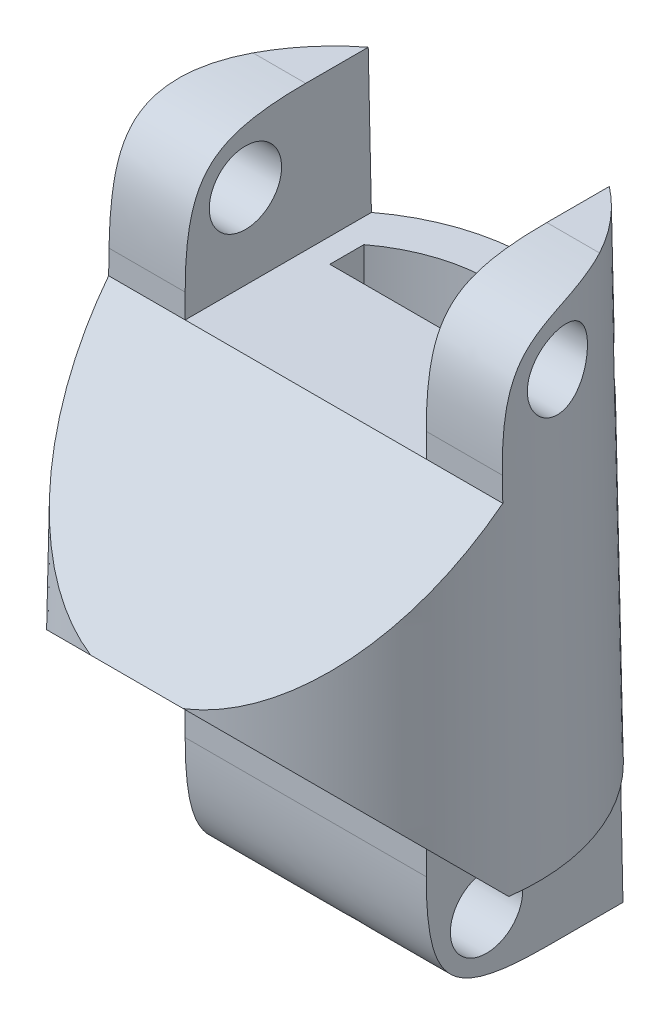
from build123d import *

# Parameters (mm, degrees)
SKETCH1_R                     = 8.5
BOSS_EXTRUDE1_DEPTH           = 20
BOSS_EXTRUDE1_TAPER           = 1
BOSS_EXTRUDE1_OTHER_WAY_DEPTH = 6
BOSS_EXTRUDE1_OTHER_WAY_TAPER = -1
CUT_EXTRUDE1_DEPTH            = 24.411167638
CUT_EXTRUDE1_DEPTH_BACK       = 24.411167638
CUT_EXTRUDE2_START            = -9.76024089
CUT_EXTRUDE2_OUTLINE_W        = 9.770566763
CUT_EXTRUDE2_OUTLINE_H        = 6
CUT_EXTRUDE2_DEPTH            = 9.76024089
CUT_EXTRUDE3_DEPTH            = 26.618184821
CUT_EXTRUDE3_DEPTH_BACK       = 26.618184821
SKETCH5_R                     = 1.5
FILLET1_SIZE                  = 5
CUT_EXTRUDE4_DEPTH            = 24.372877283
CUT_EXTRUDE4_DEPTH_BACK       = 24.372877283
SKETCH8_W                     = 10
SKETCH8_H                     = 6
CUT_EXTRUDE5_DEPTH            = 24.822516826
CUT_EXTRUDE6_DEPTH            = 26.618184821
CUT_EXTRUDE6_DEPTH_BACK       = 26.618184821
SKETCH9_R                     = 1.5
FILLET2_SIZE                  = 5
CUT_EXTRUDE7_DEPTH            = 29.675623685


with BuildPart() as part:
    # Sketch1 → Boss-Extrude1 (new body)
    with BuildSketch(Plane(origin=(0, 0, 0), x_dir=(1, 0, 0), z_dir=(0, 1, 0))):
        Circle(SKETCH1_R)
    extrude(amount=BOSS_EXTRUDE1_DEPTH, taper=BOSS_EXTRUDE1_TAPER)

    # Sketch1 → Boss-Extrude1 other way (add)
    with BuildSketch(Plane(origin=(0, 0, 0), x_dir=(1, 0, 0), z_dir=(0, 1, 0))):
        Circle(SKETCH1_R)
    extrude(amount=-BOSS_EXTRUDE1_OTHER_WAY_DEPTH, taper=BOSS_EXTRUDE1_OTHER_WAY_TAPER)

    # Sketch3 → Cut-Extrude1 (cut, two sides: drawn at the far end of the back side and taken through both)
    with BuildSketch(Plane(origin=(0, 0, 0), x_dir=(0, 0, -1), z_dir=(1, 0, 0)).offset(-CUT_EXTRUDE1_DEPTH_BACK)):
        Polygon((-1.155510401, -6), (-1.155510401, 0), (-11.155510401, 10), (-11.155510401, -6), align=None)
    extrude(amount=CUT_EXTRUDE1_DEPTH + CUT_EXTRUDE1_DEPTH_BACK, mode=Mode.SUBTRACT)

    # Cut-Extrude2: read off the stored shape, not the designer's step
    # Cut-Extrude2 outline → Cut-Extrude2 (cut)
    with BuildSketch(Plane.XY.offset(1.155510401).offset(CUT_EXTRUDE2_START)):
        with Locations((-9.885283382, -3)):
            Rectangle(CUT_EXTRUDE2_OUTLINE_W, CUT_EXTRUDE2_OUTLINE_H)
        with Locations((9.885283382, -3)):
            Rectangle(CUT_EXTRUDE2_OUTLINE_W, CUT_EXTRUDE2_OUTLINE_H)
    extrude(amount=CUT_EXTRUDE2_DEPTH, mode=Mode.SUBTRACT)

    # Sketch5 → Cut-Extrude3 (cut, two sides: drawn at the far end of the back side and taken through both)
    with BuildSketch(Plane.ZY.offset(5).offset(-CUT_EXTRUDE3_DEPTH_BACK)):
        with Locations(Location((-1.344489599, -3.5, 0), (0, 0, 270))):
            Circle(SKETCH5_R)
    extrude(amount=CUT_EXTRUDE3_DEPTH + CUT_EXTRUDE3_DEPTH_BACK, mode=Mode.SUBTRACT)

    # Fillet1
    # a fillet whose section is not a circle: 5 mm, written as the material it takes off along each edge
    with BuildSketch(Plane(origin=(17.5, -6, 1.155510401), x_dir=(0, 0, -1), z_dir=(-1, 0, 0))) as fillet1_piece_1:
        with BuildLine():
            Bezier((FILLET1_SIZE, 0), (0, 0), (0, -FILLET1_SIZE), weights=[1, 1.5, 1])
            Line((0, -FILLET1_SIZE), (0, 0))
            Line((0, 0), (FILLET1_SIZE, 0))
        make_face()
    extrude(amount=35, mode=Mode.SUBTRACT)

    # Sketch7 → Cut-Extrude4 (cut, two sides: drawn at the far end of the back side and taken through both)
    with BuildSketch(Plane(origin=(0, 0, 0), x_dir=(0, 0, -1), z_dir=(1, 0, 0)).offset(-CUT_EXTRUDE4_DEPTH_BACK)):
        Polygon((-1.155510401, 20), (-1.155510401, 14), (-12.24506556, 2.91044484), (-12.24506556, 20), align=None)
    extrude(amount=CUT_EXTRUDE4_DEPTH + CUT_EXTRUDE4_DEPTH_BACK, mode=Mode.SUBTRACT)

    # Sketch8 → Cut-Extrude5 (cut, through all)
    with BuildSketch(Plane.XY.offset(1.155510401)):
        with Locations((0, 17)):
            Rectangle(SKETCH8_W, SKETCH8_H)
    extrude(amount=-CUT_EXTRUDE5_DEPTH, mode=Mode.SUBTRACT)

    # Sketch9 → Cut-Extrude6 (cut, two sides: drawn at the far end of the back side and taken through both)
    with BuildSketch(Plane(origin=(-5, 0, 0), x_dir=(0, 0, -1), z_dir=(1, 0, 0)).offset(-CUT_EXTRUDE6_DEPTH_BACK)):
        with Locations(Location((1.344489599, 17.5, 0), (0, 0, 314.198748603))):
            Circle(SKETCH9_R)
    extrude(amount=CUT_EXTRUDE6_DEPTH + CUT_EXTRUDE6_DEPTH_BACK, mode=Mode.SUBTRACT)

    # Fillet2
    # a fillet whose section is not a circle: 5 mm, written as the material it takes off along each edge
    with BuildSketch(Plane(origin=(-20.568577654, 20, 1.155510401), x_dir=(0, 0, -1), z_dir=(1, 0, 0))) as fillet2_piece_1:
        with BuildLine():
            Bezier((FILLET2_SIZE, 0), (0, 0), (0, -FILLET2_SIZE), weights=[1, 1.5, 1])
            Line((0, -FILLET2_SIZE), (0, 0))
            Line((0, 0), (FILLET2_SIZE, 0))
        make_face()
    extrude(amount=28.068577654, mode=Mode.SUBTRACT)
    with BuildSketch(Plane(origin=(-7.5, 20, 1.155510401), x_dir=(0, -1, 0), z_dir=(1, 0, 0))) as fillet2_piece_2:
        with BuildLine():
            Bezier((FILLET2_SIZE, 0), (0, 0), (0, FILLET2_SIZE), weights=[1, 1.5, 1])
            Line((0, FILLET2_SIZE), (0, 0))
            Line((0, 0), (FILLET2_SIZE, 0))
        make_face()
    extrude(amount=28.068577654, mode=Mode.SUBTRACT)

    # Sketch10 → Cut-Extrude7 (cut, through all)
    with BuildSketch(Plane.XZ.offset(6)):
        with BuildLine():
            Line((-4, -3.844489599), (-4, -5.255707709))
            ThreePointArc((-4, -5.255707709), (0, -6.60473039), (4, -5.255707709))
            Line((4, -5.255707709), (4, -3.844489599))
            Line((4, -3.844489599), (-4, -3.844489599))
        make_face()
    extrude(amount=-CUT_EXTRUDE7_DEPTH, mode=Mode.SUBTRACT)


solid = part.part
